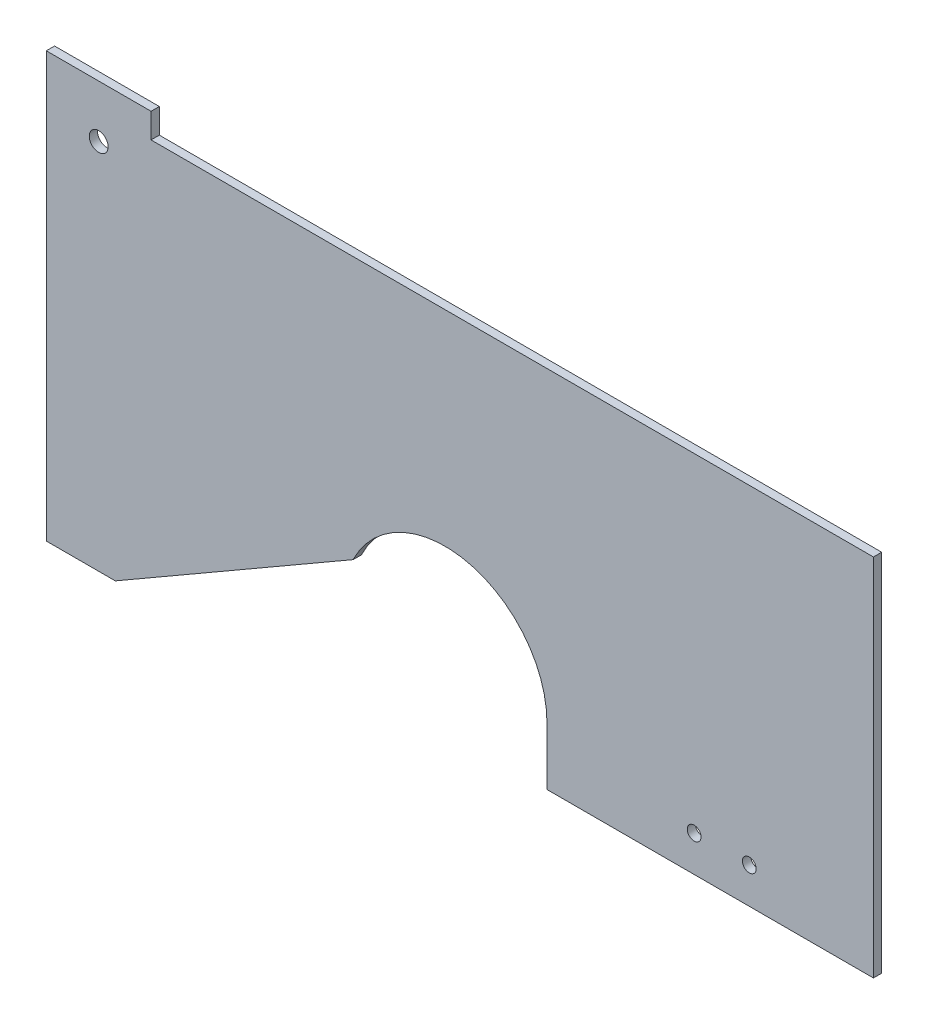
from build123d import *

# Parameters (mm, degrees)
SKETCH2_R           = 3.425
BOSS_EXTRUDE2_DEPTH = 3
SKETCH3_W           = 118.4
SKETCH3_H           = 12.75
CUT_EXTRUDE1_DEPTH  = 338.231374578
SKETCH5_R           = 2.5
CUT_EXTRUDE2_DEPTH  = 338.231374578


with BuildPart() as part:
    # Sketch2 → Boss-Extrude2 (new body)
    with BuildSketch(Plane.XY):
        with BuildLine():
            Line((25.03035901, 0), (111.286489227, 49.8))
            ThreePointArc((111.286489227, 49.8), (152.858332199, 69.766604349), (181.6, 33.7))
            Line((181.6, 33.7), (181.6, 0))
            Line((181.6, 0), (300, 0))
            Line((300, 0), (300, 145))
            Line((300, 145), (38, 145))
            Line((38, 145), (38, 154))
            Line((38, 154), (19, 154))
            Line((19, 154), (0, 154))
            Line((0, 154), (0, 0))
            Line((0, 0), (25.03035901, 0))
        make_face()
        with Locations((19, 135)):
            Circle(SKETCH2_R, mode=Mode.SUBTRACT)
    extrude(amount=BOSS_EXTRUDE2_DEPTH)

    # Sketch3 → Cut-Extrude1 (cut, through all)
    with BuildSketch(Plane.XY.offset(3)):
        with Locations((240.8, 6.375)):
            Rectangle(SKETCH3_W, SKETCH3_H)
    extrude(amount=-CUT_EXTRUDE1_DEPTH, mode=Mode.SUBTRACT)

    # Sketch5 → Cut-Extrude2 (cut, through all)
    with BuildSketch(Plane.XY.offset(3)):
        with Locations((254.98, 25.75)):
            Circle(SKETCH5_R)
        with Locations((234.98, 25.75)):
            Circle(SKETCH5_R)
    extrude(amount=-CUT_EXTRUDE2_DEPTH, mode=Mode.SUBTRACT)


solid = part.part
